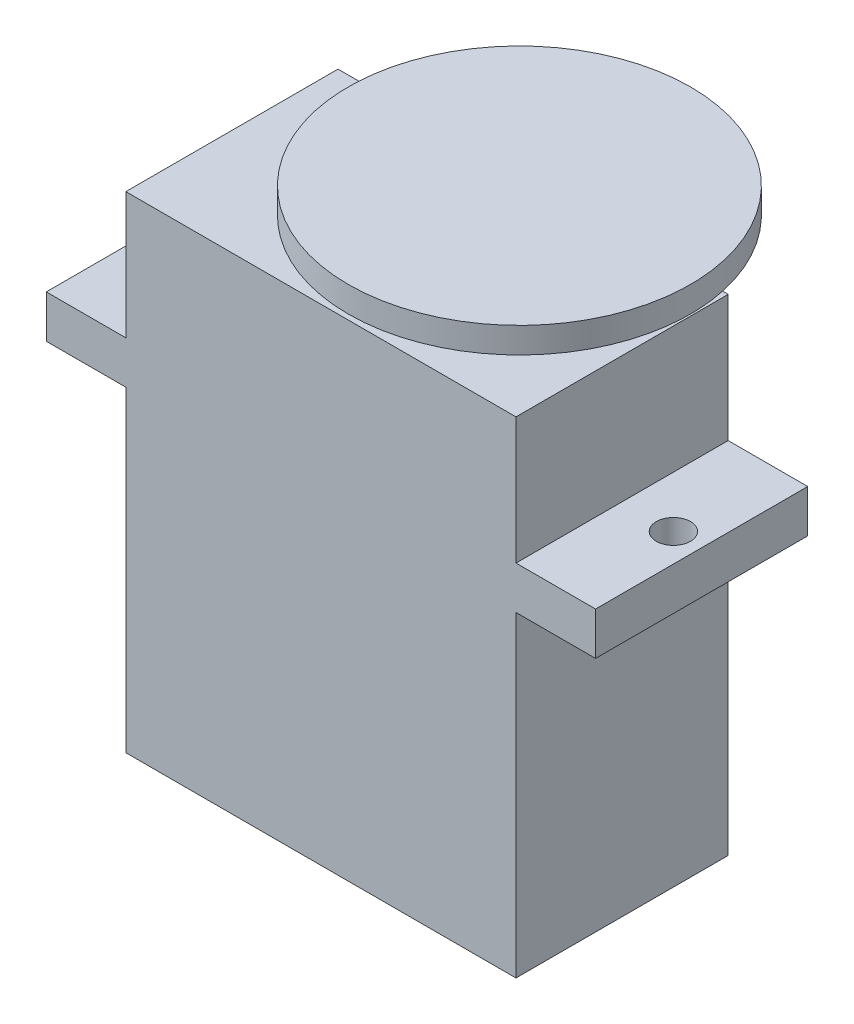
from build123d import *

# Parameters (mm, degrees)
SKETCH2_W           = 32.1
SKETCH2_H           = 12.4
BOSS_EXTRUDE1_DEPTH = 2.5
SKETCH3_W           = 22.8
SKETCH3_H           = 12.4
BOSS_EXTRUDE2_DEPTH = 18.5
SKETCH4_W           = 22.8
SKETCH4_H           = 12.4
BOSS_EXTRUDE3_DEPTH = 7.4
SKETCH5_R           = 2.5
BOSS_EXTRUDE4_DEPTH = 4.1
SKETCH6_R           = 1
CUT_EXTRUDE1_DEPTH  = 28.148526664
SKETCH7_R           = 10
BOSS_EXTRUDE5_DEPTH = 1.5


with BuildPart() as part:
    # Sketch2 → Boss-Extrude1 (new body)
    with BuildSketch(Plane(origin=(0, 0, 0), x_dir=(1, 0, 0), z_dir=(0, 1, 0))):
        Rectangle(SKETCH2_W, SKETCH2_H)
    extrude(amount=BOSS_EXTRUDE1_DEPTH)

    # Sketch3 → Boss-Extrude2 (add)
    with BuildSketch(Plane(origin=(0, 0, 0), x_dir=(-1, 0, 0), z_dir=(0, -1, 0))):
        Rectangle(SKETCH3_W, SKETCH3_H)
    extrude(amount=BOSS_EXTRUDE2_DEPTH)

    # Sketch4 → Boss-Extrude3 (add)
    with BuildSketch(Plane(origin=(0, 2.5, 0), x_dir=(1, 0, 0), z_dir=(0, 1, 0))):
        Rectangle(SKETCH4_W, SKETCH4_H)
    extrude(amount=BOSS_EXTRUDE3_DEPTH)

    # Sketch5 → Boss-Extrude4 (add)
    with BuildSketch(Plane(origin=(0, 9.9, 0), x_dir=(1, 0, 0), z_dir=(0, 1, 0))):
        with Locations((5.4, 0)):
            Circle(SKETCH5_R)
    extrude(amount=BOSS_EXTRUDE4_DEPTH)

    # Sketch6 → Cut-Extrude1 (cut, through all)
    with BuildSketch(Plane(origin=(0, 2.5, 0), x_dir=(1, 0, 0), z_dir=(0, 1, 0))):
        with Locations((-14.4, 0)):
            Circle(SKETCH6_R)
        with Locations((14.4, 0)):
            Circle(SKETCH6_R)
    extrude(amount=-CUT_EXTRUDE1_DEPTH, mode=Mode.SUBTRACT)

    # Sketch7 → Boss-Extrude5 (add)
    with BuildSketch(Plane(origin=(0, 14, 0), x_dir=(1, 0, 0), z_dir=(0, 1, 0))):
        with Locations((5.4, 0)):
            Circle(SKETCH7_R)
    extrude(amount=BOSS_EXTRUDE5_DEPTH)


solid = part.part
